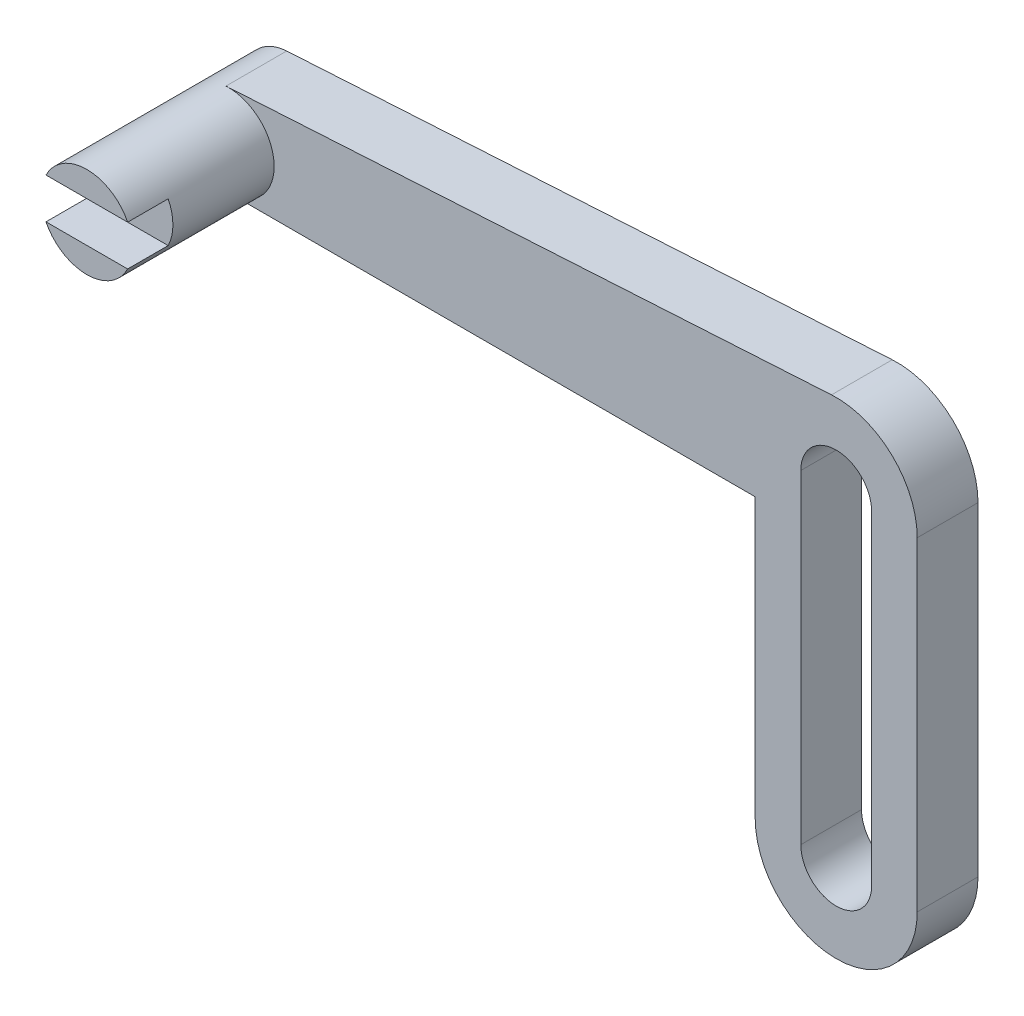
from build123d import *

# Parameters (mm, degrees)
EXTRUDE_1_DEPTH     = 3
SKETCH_1_3_R        = 2.25
EXTRUDE_2_DEPTH     = 10
SKETCH_2_W          = 5
SKETCH_2_H          = 2
CUT_EXTRUDE_1_DEPTH = 2
FILLET_1_R          = 4


with BuildPart() as part:
    # 草图1 → 凸台-拉伸1 (new body)
    with BuildSketch(Plane.XY):
        with BuildLine():
            Line((29.766666667, 3.993188645), (-0.13125, 2.246168613))
            ThreePointArc((-0.13125, 2.246168613), (-2.249041949, -0.065652955), (0, -2.25))
            Line((0, -2.25), (26, -2.25))
            Line((26, -2.25), (26, -20))
            Line((26, -20), (34, -20))
            Line((34, -20), (34, 0))
            ThreePointArc((34, 0), (32.744691847, 2.909753712), (29.766666667, 3.993188645))
        make_face()
        with BuildLine():
            Line((28.25, -16), (28.25, 0))
            ThreePointArc((28.25, 0), (30, 1.75), (31.75, 0))
            Line((31.75, 0), (31.75, -16))
            ThreePointArc((31.75, -16), (30, -17.75), (28.25, -16))
        make_face(mode=Mode.SUBTRACT)
    extrude(amount=EXTRUDE_1_DEPTH)

    # 草图1<3> → 凸台-拉伸2 (add)
    with BuildSketch(Plane.XY):
        with Locations(Location((0, 0, 0), (0, 0, 93.344152204))):
            Circle(SKETCH_1_3_R)
    extrude(amount=EXTRUDE_2_DEPTH)

    # 草图2 → 切除-拉伸1 (cut)
    with BuildSketch(Plane.XY.offset(10)):
        Rectangle(SKETCH_2_W, SKETCH_2_H)
    extrude(amount=-CUT_EXTRUDE_1_DEPTH, mode=Mode.SUBTRACT)

    # 圆角1
    fillet_1_edges = [part.edges().sort_by_distance(p)[0] for p in [
        (26, -20, 1.5),
        (34, -20, 1.5),
    ]]
    fillet(fillet_1_edges, radius=FILLET_1_R - 0.0001)  # a hair under: the kernel refuses the full size


solid = part.part
